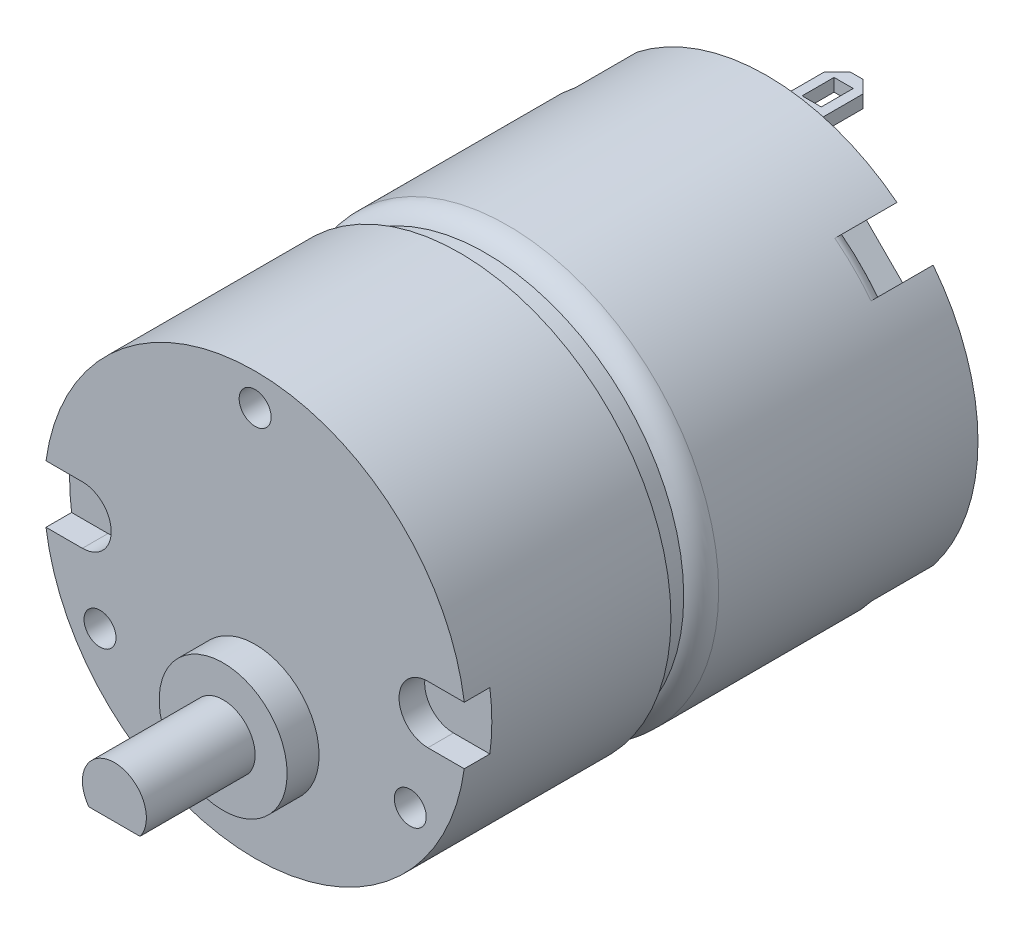
from build123d import *

# Parameters (mm, degrees)
SKETCH1_R           = 16.5
BOSS_EXTRUDE1_DEPTH = 40
SKETCH2_R           = 1.25
CUT_EXTRUDE1_DEPTH  = 5
SKETCH3_R           = 5
BOSS_EXTRUDE2_DEPTH = 2.5
BOSS_EXTRUDE3_DEPTH = 8.5
CUT_EXTRUDE2_DEPTH  = 2
CUT_EXTRUDE3_START  = -16
SKETCH6_R           = 17.194108904
SKETCH6_R_2         = 15.5
CUT_EXTRUDE3_DEPTH  = 2
FILLET1_R           = 2
SKETCH7_R           = 4.1
BOSS_EXTRUDE4_DEPTH = 3
SKETCH8_R           = 2.5
BOSS_EXTRUDE5_DEPTH = 1
SKETCH9_W           = 3
SKETCH9_H           = 1
BOSS_EXTRUDE6_DEPTH = 6
CUT_EXTRUDE4_DEPTH  = 62.184148274
SKETCH11_W          = 1.5
SKETCH11_H          = 2.5
CUT_EXTRUDE5_DEPTH  = 62.184148274
CUT_EXTRUDE6_DEPTH  = 3.85
FILLET2_R           = 1


with BuildPart() as part:
    # Sketch1 → Boss-Extrude1 (new body)
    with BuildSketch(Plane.XY):
        Circle(SKETCH1_R)
    extrude(amount=BOSS_EXTRUDE1_DEPTH)

    # Sketch2 → Cut-Extrude1 (cut)
    with BuildSketch(Plane.XY.offset(40)):
        with Locations((0, 14)):
            Circle(SKETCH2_R)
        with Locations((12.124355653, -7)):
            Circle(SKETCH2_R)
        with Locations((-12.124355653, -7)):
            Circle(SKETCH2_R)
    extrude(amount=-CUT_EXTRUDE1_DEPTH, mode=Mode.SUBTRACT)

    # Sketch3 → Boss-Extrude2 (add)
    with BuildSketch(Plane.XY.offset(40)):
        with Locations((0, -7)):
            Circle(SKETCH3_R)
    extrude(amount=BOSS_EXTRUDE2_DEPTH)

    # Sketch4 → Boss-Extrude3 (add)
    with BuildSketch(Plane.XY.offset(42.5)):
        with BuildLine():
            Line((-2, -8.5), (2, -8.5))
            ThreePointArc((2, -8.5), (0, -4.5), (-2, -8.5))
        make_face()
    extrude(amount=BOSS_EXTRUDE3_DEPTH)

    # Sketch5 → Cut-Extrude2 (cut)
    with BuildSketch(Plane.XY.offset(40)):
        with BuildLine():
            Line((-13.5, 2.25), (-17.622574656, 2.25))
            Line((-17.622574656, 2.25), (-17.622574656, -2.25))
            Line((-17.622574656, -2.25), (-13.5, -2.25))
            ThreePointArc((-13.5, -2.25), (-11.25, 0), (-13.5, 2.25))
        make_face()
        with BuildLine():
            Line((17.622574656, -2.25), (13.5, -2.25))
            ThreePointArc((13.5, -2.25), (11.25, 0), (13.5, 2.25))
            Line((13.5, 2.25), (17.622574656, 2.25))
            Line((17.622574656, 2.25), (17.622574656, -2.25))
        make_face()
    extrude(amount=-CUT_EXTRUDE2_DEPTH, mode=Mode.SUBTRACT)

    # Sketch6 → Cut-Extrude3 (cut)
    with BuildSketch(Plane.XY.offset(40).offset(CUT_EXTRUDE3_START)):
        Circle(SKETCH6_R)
        Circle(SKETCH6_R_2, mode=Mode.SUBTRACT)
    extrude(amount=-CUT_EXTRUDE3_DEPTH, mode=Mode.SUBTRACT)

    # Fillet1
    # the kernel refuses this fillet: 2 mm, written as the material it takes off along each edge
    with BuildSketch(Plane(origin=(0, 0, 22), x_dir=(1, 0, 0), z_dir=(0, 1, 0))) as fillet1_piece_1:
        with BuildLine():
            CenterArc((14.5, 1.732050808), FILLET1_R, 300, 60)
            Line((15.5, 0), (15.52, -0.034641016))
            ThreePointArc((15.52, -0.034641016), (16, -0.04), (16.5, -0.04))
            Line((16.5, -0.04), (16.54, 0))
            Line((16.54, 0), (16.54, 1.732050808))
            Line((16.54, 1.732050808), (16.5, 1.732050808))
        make_face()
    revolve(axis=Axis((0, 0, 22), (0, 0, -1)), mode=Mode.SUBTRACT)

    # Sketch7 → Boss-Extrude4 (add)
    with BuildSketch(Plane(origin=(0, 0, 0), x_dir=(-1, 0, 0), z_dir=(0, 0, -1))):
        Circle(SKETCH7_R)
    extrude(amount=BOSS_EXTRUDE4_DEPTH)

    # Sketch8 → Boss-Extrude5 (add)
    with BuildSketch(Plane(origin=(0, 0, 0), x_dir=(-1, 0, 0), z_dir=(0, 0, -1))):
        with Locations(Location((0, 12.5, 0), (0, 0, 180))):
            Circle(SKETCH8_R)
        with Locations(Location((0, -12.5, 0), (0, 0, 180))):
            Circle(SKETCH8_R)
    extrude(amount=BOSS_EXTRUDE5_DEPTH)

    # Sketch9 → Boss-Extrude6 (add)
    with BuildSketch(Plane(origin=(0, 0, -1), x_dir=(-1, 0, 0), z_dir=(0, 0, -1))):
        with Locations((0, -12.5)):
            Rectangle(SKETCH9_W, SKETCH9_H)
        with Locations((0, 12.5)):
            Rectangle(SKETCH9_W, SKETCH9_H)
    extrude(amount=BOSS_EXTRUDE6_DEPTH)

    # Sketch10 → Cut-Extrude4 (cut, through all)
    with BuildSketch(Plane(origin=(0, 13, 0), x_dir=(1, 0, 0), z_dir=(0, 1, 0))):
        Polygon((-1.5, 7), (-0.5, 7), (-1.5, 6), align=None)
        Polygon((1.5, 7), (0.5, 7), (1.5, 6), align=None)
    extrude(amount=-CUT_EXTRUDE4_DEPTH, mode=Mode.SUBTRACT)

    # Sketch11 → Cut-Extrude5 (cut, through all)
    with BuildSketch(Plane(origin=(0, 13, 0), x_dir=(1, 0, 0), z_dir=(0, 1, 0))):
        with Locations((0, 4.75)):
            Rectangle(SKETCH11_W, SKETCH11_H)
    extrude(amount=-CUT_EXTRUDE5_DEPTH, mode=Mode.SUBTRACT)

    # Sketch12 → Cut-Extrude6 (cut)
    with BuildSketch(Plane(origin=(0, 0, 0), x_dir=(-1, 0, 0), z_dir=(0, 0, -1))):
        Polygon((7.778174593, 10.606601718), (11.692726543, 14.521153668), (14.527839542, 11.699412418), (10.606601718, 7.778174593), align=None)
        Polygon((10.606601718, -7.778174593), (14.521153668, -11.692726543), (11.699412418, -14.527839542), (7.778174593, -10.606601718), align=None)
        Polygon((-7.778174593, -10.606601718), (-11.692726543, -14.521153668), (-14.527839542, -11.699412418), (-10.606601718, -7.778174593), align=None)
        Polygon((-10.606601718, 7.778174593), (-14.521153668, 11.692726543), (-11.699412418, 14.527839542), (-7.778174593, 10.606601718), align=None)
    extrude(amount=-CUT_EXTRUDE6_DEPTH, mode=Mode.SUBTRACT)

    # Fillet2
    fillet2_edges = [part.edges().sort_by_distance(p)[0] for p in [
        (-11.66726189, 11.66726189, 3.85),
        (-11.66726189, -11.66726189, 3.85),
        (11.66726189, -11.66726189, 3.85),
        (11.66726189, 11.66726189, 3.85),
    ]]
    fillet(fillet2_edges, radius=FILLET2_R)


solid = part.part
